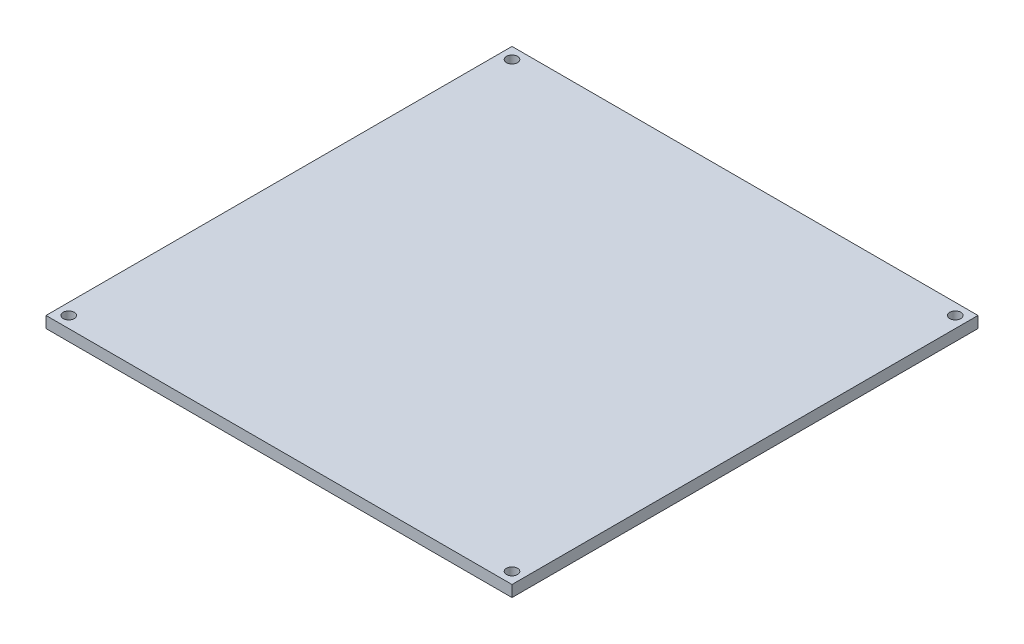
from build123d import *

# Parameters (mm, degrees)
SKETCH1_W           = 82
SKETCH1_H           = 82
SKETCH1_R           = 0.973455396
BOSS_EXTRUDE1_DEPTH = 2


with BuildPart() as part:
    # Sketch1 → Boss-Extrude1 (new body)
    with BuildSketch(Plane(origin=(0, 0, 0), x_dir=(1, 0, 0), z_dir=(0, 1, 0))):
        with Locations((-9, 22.554332031)):
            Rectangle(SKETCH1_W, SKETCH1_H)
        with Locations((-48, 61.554332031)):
            Circle(SKETCH1_R, mode=Mode.SUBTRACT)
        with Locations((30, 61.554332031)):
            Circle(SKETCH1_R, mode=Mode.SUBTRACT)
        with Locations((-48, -16.445667969)):
            Circle(SKETCH1_R, mode=Mode.SUBTRACT)
        with Locations((30, -16.445667969)):
            Circle(SKETCH1_R, mode=Mode.SUBTRACT)
    extrude(amount=BOSS_EXTRUDE1_DEPTH)


solid = part.part
